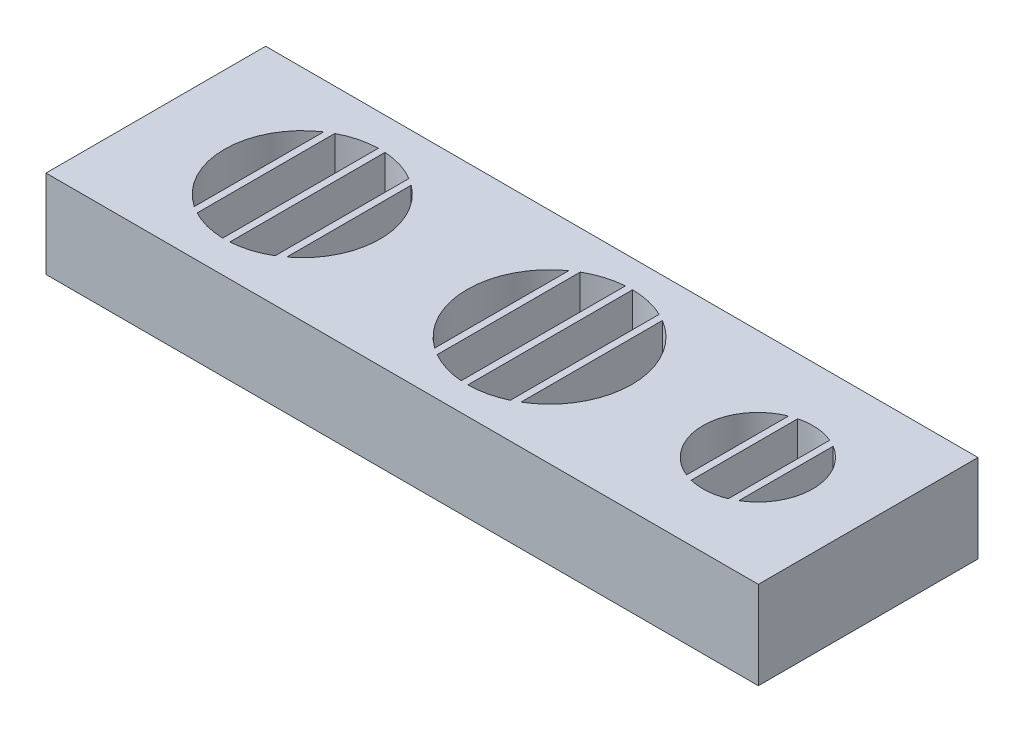
from build123d import *

# Parameters (mm, degrees)
SKETCH1_W           = 41.185763127
SKETCH1_H           = 12.7
BOSS_EXTRUDE1_DEPTH = 5.08


with BuildPart() as part:
    # Sketch1 → Boss-Extrude1 (new body)
    with BuildSketch(Plane(origin=(0, 0, 0), x_dir=(1, 0, 0), z_dir=(0, 1, 0))):
        with Locations((17.507118437, 6.35)):
            Rectangle(SKETCH1_W, SKETCH1_H)
        with BuildLine():
            Line((2.879836225, 10.091657387), (2.879836225, 2.608342613))
            ThreePointArc((2.879836225, 2.608342613), (0.879836225, 6.35), (2.879836225, 10.091657387))
        make_face(mode=Mode.SUBTRACT)
        with BuildLine():
            ThreePointArc((3.279836225, 10.329949748), (4.249648443, 10.70576349), (5.279836225, 10.848888752))
            Line((5.279836225, 10.848888752), (5.279836225, 1.851111248))
            ThreePointArc((5.279836225, 1.851111248), (4.249648443, 1.99423651), (3.279836225, 2.370050252))
            Line((3.279836225, 2.370050252), (3.279836225, 10.329949748))
        make_face(mode=Mode.SUBTRACT)
        with BuildLine():
            ThreePointArc((7.679836225, 2.482184079), (6.716539181, 2.053114476), (5.679836225, 1.860011136))
            Line((5.679836225, 1.860011136), (5.679836225, 10.839988864))
            ThreePointArc((5.679836225, 10.839988864), (6.716539181, 10.646885524), (7.679836225, 10.217815921))
            Line((7.679836225, 10.217815921), (7.679836225, 2.482184079))
        make_face(mode=Mode.SUBTRACT)
        with BuildLine():
            ThreePointArc((9.879836225, 6.35), (9.404758585, 4.33753882), (8.079836225, 2.75))
            Line((8.079836225, 2.75), (8.079836225, 9.95))
            ThreePointArc((8.079836225, 9.95), (9.404758585, 8.36246118), (9.879836225, 6.35))
        make_face(mode=Mode.SUBTRACT)
        with BuildLine():
            ThreePointArc((16.915366262, 2.470567052), (14.915366262, 6.35), (16.915366262, 10.229432948))
            Line((16.915366262, 10.229432948), (16.915366262, 2.470567052))
        make_face(mode=Mode.SUBTRACT)
        with BuildLine():
            ThreePointArc((19.315366262, 1.601315972), (18.281265952, 1.796878672), (17.315366262, 2.214785374))
            Line((17.315366262, 2.214785374), (17.315366262, 10.485214626))
            ThreePointArc((17.315366262, 10.485214626), (18.281265952, 10.903121328), (19.315366262, 11.098684028))
            Line((19.315366262, 11.098684028), (19.315366262, 1.601315972))
        make_face(mode=Mode.SUBTRACT)
        with BuildLine():
            ThreePointArc((21.715366262, 2.04535135), (20.740306577, 1.707519324), (19.715366262, 1.58764764))
            Line((19.715366262, 1.58764764), (19.715366262, 11.11235236))
            ThreePointArc((19.715366262, 11.11235236), (20.740306577, 10.992480676), (21.715366262, 10.65464865))
            Line((21.715366262, 10.65464865), (21.715366262, 2.04535135))
        make_face(mode=Mode.SUBTRACT)
        with BuildLine():
            Line((22.115366262, 2.258545491), (22.115366262, 10.441454509))
            ThreePointArc((22.115366262, 10.441454509), (24.440366262, 6.35), (22.115366262, 2.258545491))
        make_face(mode=Mode.SUBTRACT)
        with BuildLine():
            ThreePointArc((30.547464109, 3.400423759), (28.547464109, 6.35), (30.547464109, 9.299576241))
            Line((30.547464109, 9.299576241), (30.547464109, 3.400423759))
        make_face(mode=Mode.SUBTRACT)
        with BuildLine():
            ThreePointArc((32.947464109, 3.420836297), (31.959602882, 3.183868259), (30.947464109, 3.271039136))
            Line((30.947464109, 3.271039136), (30.947464109, 9.428960864))
            ThreePointArc((30.947464109, 9.428960864), (31.959602882, 9.516131741), (32.947464109, 9.279163703))
            Line((32.947464109, 9.279163703), (32.947464109, 3.420836297))
        make_face(mode=Mode.SUBTRACT)
        with BuildLine():
            Line((33.347464109, 3.622363661), (33.347464109, 9.077636339))
            ThreePointArc((33.347464109, 9.077636339), (34.897464109, 6.35), (33.347464109, 3.622363661))
        make_face(mode=Mode.SUBTRACT)
    extrude(amount=BOSS_EXTRUDE1_DEPTH)


solid = part.part
